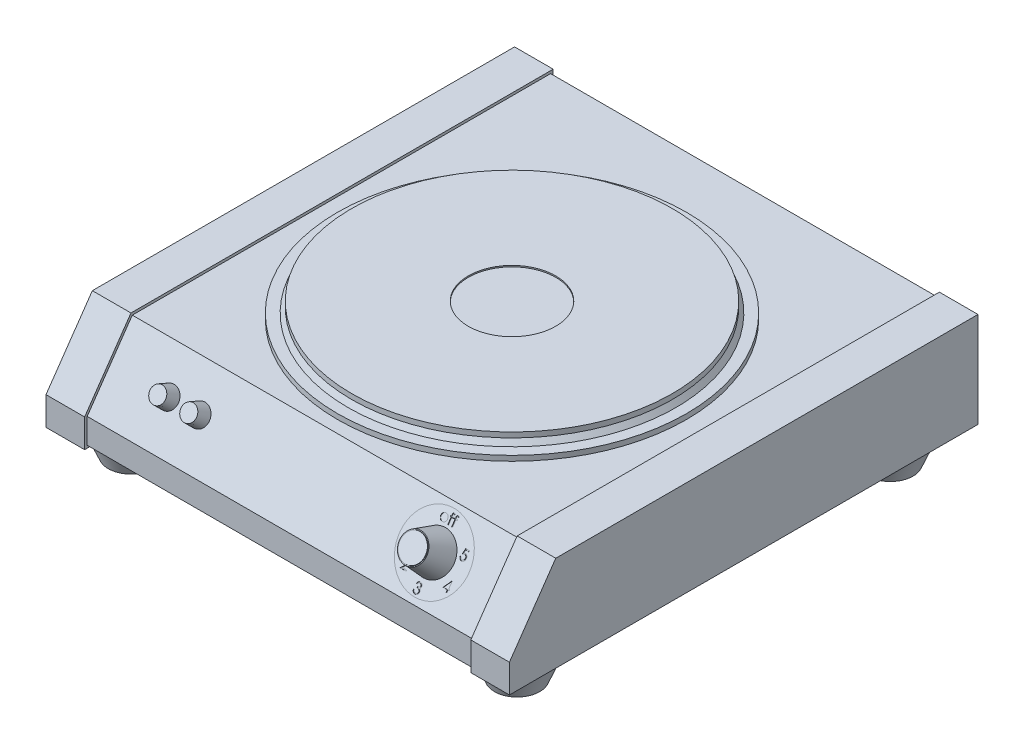
from build123d import *

# Parameters (mm, degrees)
SKETCH1_W            = 180
SKETCH1_H            = 35
BOSS_EXTRUDE1_DEPTH  = 90
CUT_EXTRUDE1_DEPTH   = 213
BOSS_EXTRUDE2_DEPTH  = 15
SKETCH4_R            = 67.753343195
BOSS_EXTRUDE3_DEPTH  = 2
SKETCH5_R            = 63.677986252
BOSS_EXTRUDE4_DEPTH  = 2
BOSS_EXTRUDE4_TAPER  = 35
SKETCH6_R            = 13.886337527
BOSS_EXTRUDE5_DEPTH  = 12
BOSS_EXTRUDE5_TAPER  = 23
LPATTERN1_COUNT      = 2
LPATTERN1_PITCH      = 150
LPATTERN1_COUNT_DIR2 = 2
LPATTERN1_PITCH_DIR2 = 145
SKETCH7_R            = 62.277571176
BOSS_EXTRUDE6_DEPTH  = 2
SKETCH8_R            = 16.972671275
CUT_EXTRUDE2_DEPTH   = 0.5
SKETCH9_R            = 13.5
CUT_EXTRUDE3_DEPTH   = 0.2
SKETCH10_R           = 13.5
BOSS_EXTRUDE7_DEPTH  = 0.2
SKETCH11_R           = 7.309665139
BOSS_EXTRUDE9_DEPTH  = 10.2
BOSS_EXTRUDE9_TAPER  = 13
SKETCH12_R           = 7.626240357
BOSS_EXTRUDE10_DEPTH = 10
BOSS_EXTRUDE10_TAPER = 13
SKETCH13_R           = 3.934172369
BOSS_EXTRUDE11_DEPTH = 5
BOSS_EXTRUDE11_TAPER = 10
WRAP1_START          = -10.2
WRAP1_DEPTH          = 0.2
SKETCH15_R           = 3.934172369
BOSS_EXTRUDE12_DEPTH = 5
BOSS_EXTRUDE12_TAPER = 10


# Read off the part's stored shape, not the designer's step: Wrap1
with BuildPart() as part:
    # Sketch1 → Boss-Extrude1 (new, symmetric)
    with BuildSketch(Plane.XY):
        Rectangle(SKETCH1_W, SKETCH1_H)
    extrude(amount=BOSS_EXTRUDE1_DEPTH, both=True)

    # Sketch2 → Cut-Extrude1 (cut)
    with BuildSketch(Plane(origin=(90, 0, 0), x_dir=(0, 0, -1), z_dir=(1, 0, 0))):
        Polygon((-90, -7.793592119), (-72.480406709, 17.5), (-90, 17.5), align=None)
    extrude(amount=-CUT_EXTRUDE1_DEPTH, mode=Mode.SUBTRACT)

    # Sketch3 → Boss-Extrude2 (add)
    with BuildSketch(Plane(origin=(90, 0, 0), x_dir=(0, 0, -1), z_dir=(1, 0, 0))):
        Polygon((91, 18.5), (-73.004212451, 18.5), (-91, -7.481088862), (-91, -18.5), (91, -18.5), align=None)
        Polygon((90, 17.5), (-72.480406709, 17.5), (-90, -7.793592119), (-90, -17.5), (90, -17.5), align=None, mode=Mode.SUBTRACT)
    boss_extrude2 = extrude(amount=-BOSS_EXTRUDE2_DEPTH)

    # Mirror1: Boss-Extrude2 across plane
    add(boss_extrude2.mirror(Plane(origin=(0, 0, 0), x_dir=(0, 0, 1), z_dir=(1, 0, 0))))

    # Sketch4 → Boss-Extrude3 (add)
    with BuildSketch(Plane(origin=(0, 17.5, 0), x_dir=(1, 0, 0), z_dir=(0, 1, 0))):
        with Locations(Location((0, 0, 0), (0, 0, 90))):
            Circle(SKETCH4_R)
    extrude(amount=BOSS_EXTRUDE3_DEPTH)

    # Sketch5 → Boss-Extrude4 (add)
    with BuildSketch(Plane(origin=(0, 19.5, 0), x_dir=(1, 0, 0), z_dir=(0, 1, 0))):
        Circle(SKETCH5_R)
    extrude(amount=BOSS_EXTRUDE4_DEPTH, taper=BOSS_EXTRUDE4_TAPER)

    # Sketch6 → Boss-Extrude5 (add)
    with BuildSketch(Plane.XZ.offset(17.5)):
        with Locations((-75, 73.016891102)):
            Circle(SKETCH6_R)
    boss_extrude5 = extrude(amount=BOSS_EXTRUDE5_DEPTH, taper=BOSS_EXTRUDE5_TAPER)

    # LPattern1: Boss-Extrude5 2 × 2
    with Locations(*[(i * LPATTERN1_PITCH, 0, -j * LPATTERN1_PITCH_DIR2) for i in range(LPATTERN1_COUNT) for j in range(LPATTERN1_COUNT_DIR2) if (i, j) != (0, 0)]):
        add(boss_extrude5)

    # Sketch7 → Boss-Extrude6 (add)
    with BuildSketch(Plane(origin=(0, 21.5, 0), x_dir=(1, 0, 0), z_dir=(0, 1, 0))):
        with Locations(Location((0, 0, 0), (0, 0, 270))):
            Circle(SKETCH7_R)
    extrude(amount=BOSS_EXTRUDE6_DEPTH)

    # Sketch8 → Cut-Extrude2 (cut)
    with BuildSketch(Plane(origin=(0, 23.5, 0), x_dir=(1, 0, 0), z_dir=(0, 1, 0))):
        with Locations(Location((0, 0, 0), (0, 0, 270))):
            Circle(SKETCH8_R)
    extrude(amount=-CUT_EXTRUDE2_DEPTH, mode=Mode.SUBTRACT)

    # Sketch9 → Cut-Extrude3 (cut)
    with BuildSketch(Plane(origin=(0, 39.600504684, 57.172503752), x_dir=(1, 0, 0), z_dir=(0, 0.5693998964979881, 0.8220606777288892))):
        with Locations(Location((51, -42.135587139, 0), (0, 0, 270))):
            Circle(SKETCH9_R)
    extrude(amount=-CUT_EXTRUDE3_DEPTH, mode=Mode.SUBTRACT)


with BuildPart() as body_2:
    # Sketch10 → Boss-Extrude7 (new body)
    with BuildSketch(Plane(origin=(0, 39.486624704, 57.008091616), x_dir=(1, 0, 0), z_dir=(0, 0.5693998964979881, 0.8220606777288891))):
        with Locations(Location((51, -42.135587139, 0), (0, 0, 270))):
            Circle(SKETCH10_R)
    extrude(amount=BOSS_EXTRUDE7_DEPTH)

    # Wrap1 outline → Wrap1 (cut)
    with BuildSketch(Plane(origin=(0, 45.294503649, 65.393110529), x_dir=(1, 0, 0), z_dir=(0, 0.5693998964979881, 0.8220606777288892)).offset(WRAP1_START)):
        with BuildLine():
            add(Edge.make_bspline(
                [(50.131299514, -31.282640847), (50.159281468, -31.314854833), (50.214703848, -31.378659375), (50.285769567, -31.482114988), (50.346991127, -31.589255089), (50.396054088, -31.701502416), (50.434739112, -31.817877087), (50.462204808, -31.938779098), (50.478541743, -32.063941445), (50.48074471, -32.148945283), (50.481860411, -32.191995815)],
                knots=[0, 0, 0, 0, 0.12815728, 0.253834363, 0.376505623, 0.498533686, 0.621367729, 0.744564745, 0.870633798, 1, 1, 1, 1], degree=3))
            add(Edge.make_bspline(
                [(49.159544706, -30.861266649), (49.207535979, -30.86228854), (49.301635136, -30.864292219), (49.439443022, -30.885707184), (49.570988158, -30.918454549), (49.69677435, -30.963726111), (49.815190646, -31.024408061), (49.92796189, -31.096817352), (50.034778899, -31.182599946), (50.098801928, -31.248958014), (50.131299514, -31.282640847)],
                knots=[0, 0, 0, 0, 0.131751427, 0.258332351, 0.382133976, 0.503804392, 0.624692987, 0.74687059, 0.871513504, 1, 1, 1, 1], degree=3))
            add(Edge.make_bspline(
                [(48.184985411, -31.284744213), (48.217434002, -31.250769274), (48.281249866, -31.183951577), (48.388598594, -31.098419053), (48.501092415, -31.024502979), (48.620817341, -30.965026764), (48.746500199, -30.918188246), (48.878719441, -30.885622731), (49.016994957, -30.864369376), (49.111554578, -30.862311198), (49.159544706, -30.861266649)],
                knots=[0, 0, 0, 0, 0.128497521, 0.252712986, 0.374819133, 0.496436426, 0.617910557, 0.741287617, 0.868700401, 1, 1, 1, 1], degree=3))
            add(Edge.make_bspline(
                [(47.834424514, -32.191995815), (47.835547824, -32.149179269), (47.837771785, -32.064409867), (47.854092295, -31.939482806), (47.881450851, -31.818785417), (47.920182247, -31.702859941), (47.969697438, -31.591104505), (48.030058726, -31.483699674), (48.101849359, -31.380711874), (48.15705131, -31.316989794), (48.184985411, -31.284744213)],
                knots=[0, 0, 0, 0, 0.128919132, 0.255237725, 0.378678596, 0.501087887, 0.622713679, 0.746240795, 0.871589047, 1, 1, 1, 1], degree=3))
            add(Edge.make_bspline(
                [(49.159544706, -33.508702546), (49.111809986, -33.50748135), (49.018319127, -33.505089575), (48.881593145, -33.486612293), (48.751603526, -33.45585431), (48.628374927, -33.411986817), (48.51123008, -33.356692274), (48.401443583, -33.288080584), (48.298243668, -33.207520429), (48.203171684, -33.115384492), (48.117173078, -33.015374535), (48.04130007, -32.910224497), (47.977409744, -32.800814404), (47.92505154, -32.686931719), (47.884219727, -32.569072987), (47.855688634, -32.446878174), (47.83734502, -32.320858806), (47.835405851, -32.235295873), (47.834424514, -32.191995815)],
                knots=[0, 0, 0, 0, 0.068742262, 0.134635192, 0.198324187, 0.260825013, 0.322713588, 0.384554535, 0.446912858, 0.510957633, 0.574930701, 0.636684538, 0.697483115, 0.757133808, 0.816965664, 0.876818352, 0.93766258, 1, 1, 1, 1], degree=3))
            add(Edge.make_bspline(
                [(50.481860411, -32.191995815), (50.480879074, -32.235295873), (50.478939905, -32.320858806), (50.460596289, -32.446878172), (50.432065203, -32.569072995), (50.391233365, -32.686931689), (50.338875256, -32.800814516), (50.274984568, -32.910224065), (50.199112951, -33.015376199), (50.113108954, -33.115378037), (50.018057078, -33.207544252), (49.91494093, -33.287872521), (49.805786896, -33.356694046), (49.689143543, -33.412130461), (49.566076056, -33.455840161), (49.436318988, -33.486540178), (49.300073918, -33.505101862), (49.207046696, -33.507485435), (49.159544706, -33.508702546)],
                knots=[0, 0, 0, 0, 0.062416026, 0.123336979, 0.18326514, 0.243172443, 0.302898354, 0.363773598, 0.425605305, 0.489659043, 0.553784577, 0.616221533, 0.677854471, 0.739516897, 0.802096536, 0.865865841, 0.931507795, 1, 1, 1, 1], degree=3))
        make_face()
        with BuildLine():
            add(Edge.make_bspline(
                [(53.712629642, -30.221843572), (53.682890863, -30.209892699), (53.626446042, -30.187209696), (53.543205666, -30.16254507), (53.466676832, -30.14660933), (53.417522942, -30.144373386), (53.394320347, -30.143317931)],
                knots=[0, 0, 0, 0, 0.29137098, 0.553028173, 0.789011488, 1, 1, 1, 1], degree=3))
            Line((53.712629642, -30.221843572), (53.712629642, -29.895120815))
            add(Edge.make_bspline(
                [(53.329817142, -29.829215367), (53.3578939, -29.830172747), (53.416839564, -29.832182717), (53.509036167, -29.844616124), (53.608632684, -29.866087154), (53.676968605, -29.885165039), (53.712629642, -29.895120815)],
                knots=[0, 0, 0, 0, 0.216182102, 0.453862855, 0.714998839, 1, 1, 1, 1], degree=3))
            add(Edge.make_bspline(
                [(52.815193744, -30.497384437), (52.815218959, -30.474708857), (52.81526733, -30.431207953), (52.818655181, -30.368598513), (52.821550901, -30.310775048), (52.827318529, -30.258186416), (52.833980235, -30.210340272), (52.843516395, -30.167947391), (52.852527766, -30.129865632), (52.868876358, -30.086762975), (52.893298577, -30.037912951), (52.932828774, -29.986289051), (52.980221781, -29.939984104), (53.036830105, -29.900976751), (53.10054564, -29.868561273), (53.171426818, -29.84531942), (53.248702016, -29.832178976), (53.302189486, -29.830224766), (53.329817142, -29.829215367)],
                knots=[0, 0, 0, 0, 0.069774923, 0.133856433, 0.192947832, 0.247915963, 0.29664228, 0.341504354, 0.381630214, 0.416904813, 0.483173328, 0.548916672, 0.616061618, 0.68630213, 0.759645114, 0.835389552, 0.914974463, 1, 1, 1, 1], degree=3))
            Line((52.815193744, -30.497384437), (52.815193744, -30.906138444))
            Line((52.815193744, -30.906138444), (52.456219385, -30.906138444))
            Line((52.456219385, -30.906138444), (52.456219385, -31.220241008))
            Line((52.456219385, -31.220241008), (52.815193744, -31.220241008))
            Line((52.815193744, -31.220241008), (52.815193744, -33.463830751))
            Line((52.815193744, -33.463830751), (53.129296309, -33.463830751))
            Line((53.129296309, -33.463830751), (53.130698552, -31.220241008))
            Line((53.130698552, -31.220241008), (53.667757847, -31.220241008))
            Line((53.667757847, -31.220241008), (53.667757847, -30.906138444))
            Line((53.667757847, -30.906138444), (53.131399674, -30.906138444))
            Line((53.131399674, -30.906138444), (53.131399674, -30.551370815))
            add(Edge.make_bspline(
                [(53.394320347, -30.143317931), (53.378646583, -30.143969271), (53.348307404, -30.145230048), (53.304704077, -30.151658324), (53.265414867, -30.164761125), (53.230509247, -30.181790401), (53.201558787, -30.203144585), (53.176772563, -30.224599849), (53.158806033, -30.24878503), (53.149051085, -30.27130544), (53.143101084, -30.292156433), (53.141310956, -30.3135107), (53.136926042, -30.339734786), (53.135703235, -30.371898504), (53.132915867, -30.409001214), (53.133162508, -30.451828111), (53.130878585, -30.499705254), (53.131220499, -30.533605802), (53.131399674, -30.551370815)],
                knots=[0, 0, 0, 0, 0.081999603, 0.158723881, 0.22942429, 0.297719362, 0.360776094, 0.416987544, 0.468545574, 0.516674948, 0.54453398, 0.581509313, 0.628334039, 0.683432546, 0.749506043, 0.822818186, 0.907150847, 1, 1, 1, 1], degree=3))
        make_face()
        with BuildLine():
            add(Edge.make_bspline(
                [(52.186988616, -30.221843572), (52.157249837, -30.209892699), (52.100805016, -30.187209696), (52.01756464, -30.16254507), (51.941035806, -30.14660933), (51.891881916, -30.144373386), (51.868679321, -30.143317931)],
                knots=[0, 0, 0, 0, 0.29137098, 0.553028173, 0.789011488, 1, 1, 1, 1], degree=3))
            Line((52.186988616, -30.221843572), (52.186988616, -29.895120815))
            add(Edge.make_bspline(
                [(51.804176116, -29.829215367), (51.832252874, -29.830172747), (51.891198539, -29.832182717), (51.983395141, -29.844616124), (52.082991659, -29.866087154), (52.15132758, -29.885165039), (52.186988616, -29.895120815)],
                knots=[0, 0, 0, 0, 0.216182102, 0.453862855, 0.714998839, 1, 1, 1, 1], degree=3))
            add(Edge.make_bspline(
                [(51.289552719, -30.497384437), (51.289577933, -30.474708857), (51.289626305, -30.431207953), (51.293014155, -30.368598513), (51.295909876, -30.310775048), (51.301677504, -30.258186416), (51.30833921, -30.210340272), (51.317875369, -30.167947391), (51.32688674, -30.129865632), (51.343235332, -30.086762975), (51.367657551, -30.037912951), (51.407187748, -29.986289051), (51.454580755, -29.939984104), (51.511189079, -29.900976751), (51.574904614, -29.868561273), (51.645785793, -29.84531942), (51.72306099, -29.832178976), (51.77654846, -29.830224766), (51.804176116, -29.829215367)],
                knots=[0, 0, 0, 0, 0.069774923, 0.133856433, 0.192947832, 0.247915963, 0.29664228, 0.341504354, 0.381630214, 0.416904813, 0.483173328, 0.548916672, 0.616061618, 0.68630213, 0.759645114, 0.835389552, 0.914974463, 1, 1, 1, 1], degree=3))
            Line((51.289552719, -30.497384437), (51.289552719, -30.906138444))
            Line((51.289552719, -30.906138444), (50.93057836, -30.906138444))
            Line((50.93057836, -30.906138444), (50.93057836, -31.220241008))
            Line((50.93057836, -31.220241008), (51.289552719, -31.220241008))
            Line((51.289552719, -31.220241008), (51.289552719, -33.463830751))
            Line((51.289552719, -33.463830751), (51.603655283, -33.463830751))
            Line((51.603655283, -33.463830751), (51.605057526, -31.220241008))
            Line((51.605057526, -31.220241008), (52.142116821, -31.220241008))
            Line((52.142116821, -31.220241008), (52.142116821, -30.906138444))
            Line((52.142116821, -30.906138444), (51.605758648, -30.906138444))
            Line((51.605758648, -30.906138444), (51.605758648, -30.551370815))
            add(Edge.make_bspline(
                [(51.868679321, -30.143317931), (51.853005557, -30.143969271), (51.822666378, -30.145230048), (51.779063051, -30.151658324), (51.739773842, -30.164761125), (51.704868221, -30.181790401), (51.675917761, -30.203144585), (51.651131537, -30.224599849), (51.633165007, -30.24878503), (51.62341006, -30.27130544), (51.617460059, -30.292156433), (51.615669931, -30.3135107), (51.611285016, -30.339734786), (51.61006221, -30.371898504), (51.607274841, -30.409001214), (51.607521482, -30.451828111), (51.605237559, -30.499705254), (51.605579474, -30.533605802), (51.605758648, -30.551370815)],
                knots=[0, 0, 0, 0, 0.081999603, 0.158723881, 0.22942429, 0.297719362, 0.360776094, 0.416987544, 0.468545574, 0.516674948, 0.54453398, 0.581509313, 0.628334039, 0.683432546, 0.749506043, 0.822818186, 0.907150847, 1, 1, 1, 1], degree=3))
        make_face()
        with BuildLine():
            add(Edge.make_bspline(
                [(49.694215988, -52.096308086), (49.702725539, -52.061075602), (49.719361014, -51.992198978), (49.754058588, -51.893791717), (49.791857843, -51.800668196), (49.837246948, -51.714572122), (49.886755702, -51.633773219), (49.943478423, -51.560104095), (50.004798146, -51.491691129), (50.072623095, -51.430977892), (50.143751757, -51.376000163), (50.219186377, -51.329125105), (50.29740927, -51.288800952), (50.378962403, -51.25558072), (50.464088575, -51.230555197), (50.552018198, -51.212398391), (50.642981698, -51.200607277), (50.704729289, -51.199456514), (50.736082975, -51.198872189)],
                knots=[0, 0, 0, 0, 0.072625346, 0.141976611, 0.208984928, 0.27395687, 0.336889347, 0.398744953, 0.460115885, 0.520824923, 0.580994459, 0.640151928, 0.698622451, 0.757271081, 0.816426694, 0.876254048, 0.937165293, 1, 1, 1, 1], degree=3))
            Line((49.694215988, -52.096308086), (50.008318552, -52.096308086))
            add(Edge.make_bspline(
                [(50.740289706, -51.557846548), (50.700438038, -51.55923791), (50.622598462, -51.561955563), (50.510383545, -51.585758577), (50.406064211, -51.62373666), (50.326325544, -51.66906968), (50.26744297, -51.713820114), (50.225366032, -51.7529025), (50.184045521, -51.796335324), (50.146199845, -51.846793699), (50.107925868, -51.900860489), (50.073081306, -51.961284171), (50.039221614, -52.026488565), (50.018819064, -52.0725842), (50.008318552, -52.096308086)],
                knots=[0, 0, 0, 0, 0.122711942, 0.239684964, 0.351815855, 0.463766133, 0.520817793, 0.579448291, 0.640604145, 0.705297512, 0.773633881, 0.844669382, 0.920056508, 1, 1, 1, 1], degree=3))
            add(Edge.make_bspline(
                [(51.444215988, -52.106824913), (51.443801577, -52.088547168), (51.442977126, -52.052184461), (51.432579848, -51.999059392), (51.416955807, -51.947558446), (51.395476078, -51.897900636), (51.366725879, -51.850430362), (51.332319893, -51.804742913), (51.291351793, -51.761099134), (51.244406346, -51.720418815), (51.193994541, -51.681649578), (51.138744766, -51.648735941), (51.080322891, -51.620590878), (51.018664236, -51.597381376), (50.953568706, -51.579922088), (50.885342148, -51.567386247), (50.813854465, -51.559548592), (50.765082732, -51.558420176), (50.740289706, -51.557846548)],
                knots=[0, 0, 0, 0, 0.055274549, 0.109966094, 0.163247443, 0.218076185, 0.273300874, 0.3309093, 0.390994523, 0.454175953, 0.518861541, 0.583310532, 0.648516682, 0.715030887, 0.782502073, 0.852322685, 0.92492849, 1, 1, 1, 1], degree=3))
            add(Edge.make_bspline(
                [(50.546780091, -52.67964142), (50.590081256, -52.678906616), (50.674897603, -52.677467316), (50.798791908, -52.660059305), (50.91726522, -52.635978677), (51.027691962, -52.599093485), (51.128340675, -52.556253188), (51.215660277, -52.506400979), (51.288427425, -52.45098623), (51.346288496, -52.38915362), (51.389817725, -52.322838573), (51.421644522, -52.253721915), (51.440444848, -52.181197854), (51.442954515, -52.131703186), (51.444215988, -52.106824913)],
                knots=[0, 0, 0, 0, 0.110165553, 0.215787256, 0.318027435, 0.417573954, 0.511650488, 0.596162097, 0.672934533, 0.743669557, 0.810677001, 0.874058962, 0.936696302, 1, 1, 1, 1], degree=3))
            Line((50.546780091, -52.67964142), (50.546780091, -53.038615779))
            add(Edge.make_bspline(
                [(51.623703168, -53.779000394), (51.622172866, -53.746389055), (51.619119878, -53.681328647), (51.595811298, -53.585611073), (51.557472434, -53.49338766), (51.503799923, -53.40623187), (51.438464194, -53.325455969), (51.362099287, -53.253384486), (51.274071059, -53.193914395), (51.19305119, -53.152825739), (51.121286033, -53.124788663), (51.059870649, -53.106113699), (50.991114045, -53.090300043), (50.915847696, -53.075587772), (50.83350448, -53.063066424), (50.744174042, -53.052624608), (50.64783828, -53.044269567), (50.581147115, -53.040538472), (50.546780091, -53.038615779)],
                knots=[0, 0, 0, 0, 0.066909186, 0.13348544, 0.201035117, 0.27123434, 0.342879984, 0.41383613, 0.485976622, 0.560229557, 0.599884181, 0.64405484, 0.691891932, 0.744687524, 0.801491775, 0.862857698, 0.929328379, 1, 1, 1, 1], degree=3))
            add(Edge.make_bspline(
                [(50.732577366, -54.519385009), (50.765330869, -54.518769104), (50.829377516, -54.517564755), (50.922832375, -54.506489048), (51.011739823, -54.490358634), (51.095112749, -54.465445651), (51.174043256, -54.4346648), (51.247424905, -54.396016395), (51.316221012, -54.350671673), (51.379550417, -54.299132514), (51.436495925, -54.242711019), (51.486635438, -54.183697948), (51.529260099, -54.122342119), (51.563643678, -54.058303998), (51.590794228, -53.991848769), (51.609277428, -53.922789939), (51.622128944, -53.851692673), (51.623175556, -53.803363704), (51.623703168, -53.779000394)],
                knots=[0, 0, 0, 0, 0.076071737, 0.148751715, 0.218402794, 0.285759581, 0.350598024, 0.414964045, 0.478069339, 0.541760676, 0.604349859, 0.664075021, 0.721463623, 0.777587128, 0.832644447, 0.887843511, 0.943460343, 1, 1, 1, 1], degree=3))
            add(Edge.make_bspline(
                [(50.147841789, -54.330082125), (50.167438366, -54.345190459), (50.206571029, -54.37536049), (50.27033926, -54.413862119), (50.337404146, -54.447223144), (50.40921882, -54.47270684), (50.484233591, -54.494284501), (50.563660956, -54.50840502), (50.646800173, -54.518093191), (50.703567936, -54.518948123), (50.732577366, -54.519385009)],
                knots=[0, 0, 0, 0, 0.118271305, 0.236177533, 0.355662933, 0.475904165, 0.600127342, 0.728608116, 0.861313476, 1, 1, 1, 1], degree=3))
            add(Edge.make_bspline(
                [(49.873703168, -53.846308086), (49.881886459, -53.8732571), (49.897803672, -53.925675271), (49.92489797, -54.001115577), (49.955766242, -54.07027363), (49.9888808, -54.133656752), (50.023659246, -54.191889154), (50.062574172, -54.243431024), (50.102743317, -54.290546226), (50.13302267, -54.317090838), (50.147841789, -54.330082125)],
                knots=[0, 0, 0, 0, 0.149770386, 0.29131641, 0.425966373, 0.552159574, 0.671527414, 0.786121629, 0.895325073, 1, 1, 1, 1], degree=3))
            Line((49.873703168, -53.846308086), (49.559600603, -53.846308086))
            add(Edge.make_bspline(
                [(50.726968392, -54.878359368), (50.689549092, -54.877491155), (50.615920387, -54.875782801), (50.507676888, -54.8641042), (50.404355189, -54.842774194), (50.305815591, -54.814070889), (50.211970555, -54.777679147), (50.123106449, -54.732360449), (50.038676556, -54.679048947), (49.959477605, -54.617115359), (49.885519037, -54.547834019), (49.818766313, -54.469975009), (49.75810652, -54.384977605), (49.705163881, -54.291854549), (49.657526929, -54.191809292), (49.618345972, -54.083560794), (49.583860403, -53.968076772), (49.567826939, -53.887599031), (49.559600603, -53.846308086)],
                knots=[0, 0, 0, 0, 0.06554117, 0.128963168, 0.190377136, 0.250092362, 0.308548432, 0.366397963, 0.424542189, 0.483169996, 0.5422434, 0.601739352, 0.662506002, 0.724855513, 0.789127829, 0.8563464, 0.926295235, 1, 1, 1, 1], degree=3))
            add(Edge.make_bspline(
                [(51.937805732, -53.748852157), (51.936011218, -53.797861878), (51.932430636, -53.89565068), (51.900426562, -54.040125401), (51.850813321, -54.181350904), (51.780356385, -54.316425743), (51.694488876, -54.442806124), (51.592331552, -54.555882433), (51.475045144, -54.653081037), (51.344239495, -54.734291265), (51.202522366, -54.799209188), (51.050946774, -54.84426663), (50.89169672, -54.87361263), (50.782489423, -54.876759499), (50.726968392, -54.878359368)],
                knots=[0, 0, 0, 0, 0.079648251, 0.158921676, 0.239619495, 0.32260943, 0.406034637, 0.487602095, 0.569684627, 0.653036145, 0.737435718, 0.822477816, 0.909747655, 1, 1, 1, 1], degree=3))
            add(Edge.make_bspline(
                [(51.728871437, -53.126957125), (51.745712779, -53.150014876), (51.779119675, -53.195752793), (51.820355209, -53.269289219), (51.857764323, -53.343640708), (51.886914543, -53.420800114), (51.909488409, -53.499873128), (51.925624442, -53.580995524), (51.935648583, -53.664233546), (51.937084135, -53.720546026), (51.937805732, -53.748852157)],
                knots=[0, 0, 0, 0, 0.12813551, 0.254172712, 0.378111645, 0.501712263, 0.623986309, 0.747095614, 0.872874637, 1, 1, 1, 1], degree=3))
            add(Edge.make_bspline(
                [(51.349564546, -52.82827924), (51.3867963, -52.846257412), (51.460563175, -52.881877369), (51.561113704, -52.951733127), (51.65239158, -53.032389474), (51.703295299, -53.095332127), (51.728871437, -53.126957125)],
                knots=[0, 0, 0, 0, 0.2538796, 0.503008917, 0.750291081, 1, 1, 1, 1], degree=3))
            add(Edge.make_bspline(
                [(51.758318552, -52.108227157), (51.757154961, -52.145233951), (51.754877994, -52.217650506), (51.735544288, -52.323372003), (51.703008026, -52.423013603), (51.657938263, -52.516994765), (51.599596713, -52.604719605), (51.528924016, -52.686385496), (51.445421354, -52.762354654), (51.382142416, -52.805874127), (51.349564546, -52.82827924)],
                knots=[0, 0, 0, 0, 0.128067549, 0.250608319, 0.370630166, 0.490072247, 0.610374764, 0.73431307, 0.863216504, 1, 1, 1, 1], degree=3))
            add(Edge.make_bspline(
                [(50.736082975, -51.198872189), (50.781765717, -51.200251419), (50.872134728, -51.202979795), (51.004897775, -51.227894231), (51.132924594, -51.267319363), (51.254813842, -51.321793091), (51.368032275, -51.388980404), (51.468768461, -51.468945141), (51.555656972, -51.560144442), (51.62855135, -51.660877006), (51.685626349, -51.768532516), (51.727712722, -51.879332673), (51.753334403, -51.993014644), (51.75665496, -52.069771923), (51.758318552, -52.108227157)],
                knots=[0, 0, 0, 0, 0.090254249, 0.178539792, 0.266093034, 0.354630978, 0.441886153, 0.525746915, 0.608113634, 0.690197273, 0.770821484, 0.848326181, 0.92401174, 1, 1, 1, 1], degree=3))
        make_face()
        with BuildLine():
            add(Edge.make_bspline(
                [(42.632235888, -48.149143568), (42.634283041, -48.10747268), (42.638303595, -48.025632166), (42.657131885, -47.906308259), (42.684072762, -47.792253461), (42.722164216, -47.684383547), (42.769470493, -47.581744739), (42.826200521, -47.484744724), (42.893394371, -47.393753535), (42.969601105, -47.309614692), (43.052369744, -47.232427121), (43.141675684, -47.165771878), (43.235520711, -47.109454207), (43.33362011, -47.062372965), (43.437080674, -47.027033119), (43.544963532, -47.000811479), (43.657742668, -46.985035134), (43.73458269, -46.983339348), (43.77366217, -46.982476901)],
                knots=[0, 0, 0, 0, 0.068790794, 0.135103289, 0.198978674, 0.2619043, 0.323494969, 0.385195378, 0.446969239, 0.509764777, 0.572250569, 0.633405176, 0.693251163, 0.752583163, 0.812579266, 0.873275085, 0.935549943, 1, 1, 1, 1], degree=3))
            Line((42.632235888, -48.149143568), (42.946338452, -48.149143568))
            add(Edge.make_bspline(
                [(43.757536369, -47.34145126), (43.730165536, -47.342166293), (43.67641374, -47.343570498), (43.597494707, -47.353393162), (43.52220893, -47.370339002), (43.450367027, -47.393515677), (43.381847441, -47.422974225), (43.316983397, -47.45966597), (43.255920507, -47.503449463), (43.198543984, -47.55309002), (43.145680005, -47.608357621), (43.099233129, -47.669967584), (43.058649115, -47.736794999), (43.023239882, -47.80865955), (42.994484192, -47.88621333), (42.972511041, -47.969181035), (42.955124194, -48.057202416), (42.949315674, -48.117987501), (42.946338452, -48.149143568)],
                knots=[0, 0, 0, 0, 0.064438672, 0.126546911, 0.186887153, 0.245877536, 0.304040885, 0.362191218, 0.420975933, 0.480660283, 0.540600275, 0.600689098, 0.66193579, 0.724442506, 0.789038394, 0.856313757, 0.926352028, 1, 1, 1, 1], degree=3))
            add(Edge.make_bspline(
                [(44.516851273, -48.050986517), (44.516215531, -48.027105118), (44.514962605, -47.980039468), (44.503904907, -47.911033709), (44.487194401, -47.844468895), (44.463249143, -47.780140276), (44.431642403, -47.718694624), (44.393169023, -47.660057144), (44.348778959, -47.603368179), (44.29742769, -47.55021488), (44.24101617, -47.501533675), (44.181421921, -47.45840959), (44.118371816, -47.422370479), (44.052131694, -47.392826982), (43.982886225, -47.3696516), (43.91050148, -47.353593021), (43.835177464, -47.343510537), (43.783743968, -47.342146365), (43.757536369, -47.34145126)],
                knots=[0, 0, 0, 0, 0.061965401, 0.122121906, 0.180988497, 0.239933216, 0.299905831, 0.359988847, 0.421775742, 0.486575826, 0.551534805, 0.615017543, 0.677258617, 0.739729962, 0.803050103, 0.866495132, 0.931973474, 1, 1, 1, 1], degree=3))
            add(Edge.make_bspline(
                [(43.854992298, -49.123702863), (43.888040185, -49.089204556), (43.951518412, -49.02294037), (44.041300989, -48.92619741), (44.121939978, -48.836447869), (44.19395737, -48.75386132), (44.255790876, -48.677229753), (44.310663108, -48.609035049), (44.354628699, -48.546280599), (44.402344094, -48.473539985), (44.448558076, -48.384727668), (44.488270432, -48.276193978), (44.51248528, -48.164466726), (44.515390116, -48.088964689), (44.516851273, -48.050986517)],
                knots=[0, 0, 0, 0, 0.110802644, 0.212829202, 0.30610131, 0.390647321, 0.466924469, 0.534481039, 0.593586941, 0.644557005, 0.736200453, 0.825024026, 0.911985585, 1, 1, 1, 1], degree=3))
            Line((43.854992298, -49.123702863), (42.497620504, -50.572220491))
            Line((42.497620504, -50.572220491), (44.875825632, -50.572220491))
            Line((44.875825632, -50.572220491), (44.875825632, -50.213246132))
            Line((44.875825632, -50.213246132), (43.247119702, -50.213246132))
            Line((43.247119702, -50.213246132), (44.122820824, -49.27865078))
            add(Edge.make_bspline(
                [(44.830953837, -48.022941645), (44.829260574, -48.07168948), (44.825903763, -48.168329693), (44.797189386, -48.310344556), (44.752342875, -48.447937975), (44.698345518, -48.558675277), (44.643873074, -48.647908771), (44.594785567, -48.721377476), (44.537320756, -48.800482944), (44.470642258, -48.884960282), (44.396129385, -48.975471187), (44.313107222, -49.071960982), (44.22098374, -49.173432752), (44.156325239, -49.242738353), (44.122820824, -49.27865078)],
                knots=[0, 0, 0, 0, 0.098702196, 0.195672309, 0.292422427, 0.391342544, 0.444462441, 0.504228775, 0.570352338, 0.642545753, 0.722287505, 0.807921123, 0.900469538, 1, 1, 1, 1], degree=3))
            add(Edge.make_bspline(
                [(43.77366217, -46.982476901), (43.812040244, -46.983375358), (43.887451789, -46.985140793), (43.997513803, -47.000301822), (44.102291098, -47.024047414), (44.201578864, -47.05736283), (44.294584929, -47.102147257), (44.382007974, -47.155944796), (44.464888784, -47.218164627), (44.539495568, -47.291418441), (44.608003647, -47.369620825), (44.667105902, -47.453108729), (44.717719066, -47.539338014), (44.759906746, -47.628966216), (44.790962885, -47.722837244), (44.814541093, -47.819584447), (44.827868506, -47.920209258), (44.82991393, -47.988315814), (44.830953837, -48.022941645)],
                knots=[0, 0, 0, 0, 0.06947546, 0.136516798, 0.200788824, 0.263829673, 0.325735023, 0.387290692, 0.449509219, 0.51296782, 0.576275215, 0.6375801, 0.697902606, 0.757172088, 0.816598528, 0.876653171, 0.937289642, 1, 1, 1, 1], degree=3))
        make_face()
        with BuildLine():
            add(Edge.make_bspline(
                [(60.200642838, -38.046476002), (60.237698713, -38.03624573), (60.309488609, -38.016426196), (60.41544847, -37.994420426), (60.516040673, -37.981154982), (60.581316043, -37.979343671), (60.612902454, -37.978467188)],
                knots=[0, 0, 0, 0, 0.275068369, 0.53290146, 0.77397346, 1, 1, 1, 1], degree=3))
            Line((60.200642838, -38.046476002), (60.389244601, -37.125903085))
            Line((60.389244601, -37.125903085), (61.579749409, -37.125903085))
            Line((61.579749409, -37.125903085), (61.579749409, -36.766928726))
            Line((61.579749409, -36.766928726), (60.143851973, -36.766928726))
            Line((60.143851973, -36.766928726), (59.784877614, -38.516928726))
            add(Edge.make_bspline(
                [(60.556111588, -38.337441547), (60.52898266, -38.338022138), (60.472968304, -38.339220911), (60.387045478, -38.348047408), (60.296753755, -38.362286702), (60.202439259, -38.38187295), (60.103818751, -38.407504027), (60.00110035, -38.438218527), (59.894068084, -38.474940526), (59.821950359, -38.50267274), (59.784877614, -38.516928726)],
                knots=[0, 0, 0, 0, 0.102203037, 0.211023342, 0.325099662, 0.446502097, 0.573787718, 0.70890071, 0.850357871, 1, 1, 1, 1], degree=3))
            add(Edge.make_bspline(
                [(61.400262229, -39.110077765), (61.39960375, -39.082002013), (61.39831487, -39.027047724), (61.3877843, -38.946648517), (61.369467327, -38.870575475), (61.344043448, -38.798461241), (61.31176394, -38.730237799), (61.272317627, -38.665834739), (61.22496423, -38.606100905), (61.170872341, -38.551008352), (61.1116143, -38.500163477), (61.046170557, -38.45681939), (60.975910631, -38.420355473), (60.901681031, -38.388887474), (60.821716133, -38.366286729), (60.7375995, -38.349318844), (60.648422792, -38.339503481), (60.587452104, -38.338141593), (60.556111588, -38.337441547)],
                knots=[0, 0, 0, 0, 0.065351382, 0.127916032, 0.188360206, 0.247216077, 0.305630129, 0.36376984, 0.422660914, 0.482687294, 0.543300221, 0.604117955, 0.664964891, 0.727413494, 0.791467625, 0.858055443, 0.927036815, 1, 1, 1, 1], degree=3))
            add(Edge.make_bspline(
                [(60.511940915, -39.997697957), (60.54189936, -39.996877179), (60.600887782, -39.995261061), (60.687699169, -39.982822048), (60.771512043, -39.963664477), (60.8514994, -39.934994622), (60.929060939, -39.900149904), (61.00223471, -39.855434828), (61.073137587, -39.803974809), (61.13956572, -39.745018179), (61.20040517, -39.680048485), (61.254161291, -39.610571091), (61.298938204, -39.536454245), (61.336672313, -39.458981092), (61.365325612, -39.377302535), (61.385766593, -39.29180136), (61.397769652, -39.202266379), (61.399420832, -39.14119707), (61.400262229, -39.110077765)],
                knots=[0, 0, 0, 0, 0.064207295, 0.12642469, 0.187680284, 0.248216424, 0.30830506, 0.369660991, 0.431698552, 0.495946892, 0.559758024, 0.622295408, 0.683910635, 0.745092408, 0.806740225, 0.869086618, 0.933290003, 1, 1, 1, 1], degree=3))
            add(Edge.make_bspline(
                [(59.740005819, -39.369492829), (59.747734377, -39.402869281), (59.762589093, -39.467020676), (59.795194842, -39.557152017), (59.835060717, -39.637471241), (59.882465066, -39.709040824), (59.939015096, -39.771449822), (60.003544525, -39.827066883), (60.075892248, -39.877242013), (60.156285478, -39.91906478), (60.241098557, -39.954733533), (60.329865767, -39.978485228), (60.420170114, -39.995186121), (60.481248484, -39.996857882), (60.511940915, -39.997697957)],
                knots=[0, 0, 0, 0, 0.094687252, 0.181994156, 0.264376949, 0.342179862, 0.418617611, 0.496509075, 0.577369092, 0.661510592, 0.746732551, 0.831257984, 0.915205616, 1, 1, 1, 1], degree=3))
            Line((59.740005819, -39.369492829), (59.425903255, -39.369492829))
            add(Edge.make_bspline(
                [(60.493711749, -40.356672316), (60.458837568, -40.355981478), (60.390226737, -40.354622336), (60.28970617, -40.34040385), (60.192991565, -40.320039934), (60.100861463, -40.289403664), (60.0124902, -40.25101637), (59.929067482, -40.202500198), (59.848461706, -40.147521094), (59.773949669, -40.082640741), (59.704793556, -40.011725059), (59.642887047, -39.934767418), (59.58775347, -39.853037976), (59.540275723, -39.766139822), (59.499777702, -39.674301291), (59.467962713, -39.57717829), (59.442284358, -39.475278286), (59.431420938, -39.405124776), (59.425903255, -39.369492829)],
                knots=[0, 0, 0, 0, 0.065421144, 0.128708372, 0.190236142, 0.250724402, 0.310637179, 0.370766408, 0.431614744, 0.493522974, 0.555883455, 0.617342367, 0.678668039, 0.74071136, 0.802985363, 0.86680258, 0.932347171, 1, 1, 1, 1], degree=3))
            add(Edge.make_bspline(
                [(61.714364794, -39.123399079), (61.713699718, -39.151921299), (61.712378556, -39.208580287), (61.705659968, -39.292724487), (61.692724252, -39.37508732), (61.675356528, -39.455679712), (61.65281411, -39.534349084), (61.625525056, -39.611320612), (61.592129028, -39.686115219), (61.555497653, -39.759440614), (61.514251175, -39.829639121), (61.468472668, -39.895288108), (61.420107177, -39.957372389), (61.368065791, -40.015226122), (61.311864796, -40.06846914), (61.252184829, -40.117417422), (61.18950211, -40.162898752), (61.122846868, -40.203066947), (61.053704385, -40.240029903), (60.981076168, -40.270353441), (60.906615467, -40.297463969), (60.829250592, -40.319073496), (60.749156779, -40.336006051), (60.666202004, -40.347506651), (60.580821334, -40.355883089), (60.522946321, -40.356407446), (60.493711749, -40.356672316)],
                knots=[0, 0, 0, 0, 0.044014471, 0.087434124, 0.130118399, 0.172553695, 0.214554756, 0.256298092, 0.298438225, 0.340849003, 0.382715189, 0.423924045, 0.464246243, 0.504073671, 0.543861906, 0.583566725, 0.623094319, 0.663229061, 0.703551259, 0.743937895, 0.784541255, 0.825750111, 0.867757363, 0.910745164, 0.954914447, 1, 1, 1, 1], degree=3))
            add(Edge.make_bspline(
                [(60.612902454, -37.978467188), (60.651986194, -37.979313123), (60.728834591, -37.980976444), (60.841273538, -37.996948294), (60.948606431, -38.022088208), (61.050608801, -38.05720873), (61.147469352, -38.102118463), (61.238296913, -38.158218404), (61.324454826, -38.223751735), (61.40439742, -38.299096747), (61.476921728, -38.382018363), (61.540687718, -38.471176235), (61.594850308, -38.565703897), (61.638411063, -38.666504505), (61.673195398, -38.772463659), (61.696347392, -38.884696241), (61.711764101, -39.002144361), (61.713486488, -39.082448931), (61.714364794, -39.123399079)],
                knots=[0, 0, 0, 0, 0.065807646, 0.129394274, 0.190894061, 0.251281069, 0.310814964, 0.370370987, 0.430768263, 0.492881251, 0.555103948, 0.616067051, 0.677256033, 0.738259805, 0.800762134, 0.864777582, 0.931045295, 1, 1, 1, 1], degree=3))
        make_face()
        Polygon((41.527312063, -43.35491237), (41.527312063, -39.85491237), (40.880176646, -39.85491237), (40.67474796, -40.213886729), (41.213209499, -40.213886729), (41.213209499, -43.35491237), align=None)
        Polygon((60.443400426, -48.921692916), (60.443400426, -46.498615993), (60.379598343, -46.498615993), (58.469041452, -49.280667275), (60.129297862, -49.280667275), (60.129297862, -50.088359583), (60.443400426, -50.088359583), (60.443400426, -49.280667275), (60.84724658, -49.280667275), (60.84724658, -48.921692916), align=None)
    extrude(amount=WRAP1_DEPTH, mode=Mode.SUBTRACT)


with BuildPart() as body_3:
    # Sketch11 → Boss-Extrude9 (new body)
    with BuildSketch(Plane(origin=(0, 39.600504684, 57.172503752), x_dir=(1, 0, 0), z_dir=(0, 0.5693998964979881, 0.8220606777288891))):
        with Locations((51, -42.135587139)):
            Circle(SKETCH11_R)
    extrude(amount=BOSS_EXTRUDE9_DEPTH, taper=BOSS_EXTRUDE9_TAPER)


with BuildPart() as body_4:
    # Sketch12 → Boss-Extrude10 (new body)
    with BuildSketch(Plane(origin=(0, 39.600504684, 57.172503752), x_dir=(1, 0, 0), z_dir=(0, 0.5693998964979881, 0.8220606777288891))):
        with Locations((51, -42.135587139)):
            Circle(SKETCH12_R)
    extrude(amount=BOSS_EXTRUDE10_DEPTH, taper=BOSS_EXTRUDE10_TAPER)


with BuildPart() as body_5:
    # Sketch13 → Boss-Extrude11 (new body)
    with BuildSketch(Plane(origin=(0, 39.600504684, 57.172503752), x_dir=(1, 0, 0), z_dir=(0, 0.5693998964979881, 0.8220606777288892))):
        with Locations((-52.577890362, -41.679881769)):
            Circle(SKETCH13_R)
    extrude(amount=BOSS_EXTRUDE11_DEPTH, taper=BOSS_EXTRUDE11_TAPER)


with BuildPart() as body_6:
    # Sketch15 → Boss-Extrude12 (new body)
    with BuildSketch(Plane(origin=(0, 39.600504684, 57.172503752), x_dir=(1, 0, 0), z_dir=(0, 0.5693998964979881, 0.8220606777288892))):
        with Locations((-40.533984503, -41.679881769)):
            Circle(SKETCH15_R)
    extrude(amount=BOSS_EXTRUDE12_DEPTH, taper=BOSS_EXTRUDE12_TAPER)


solid = Compound([part.part, body_2.part, body_3.part, body_4.part, body_5.part, body_6.part])
